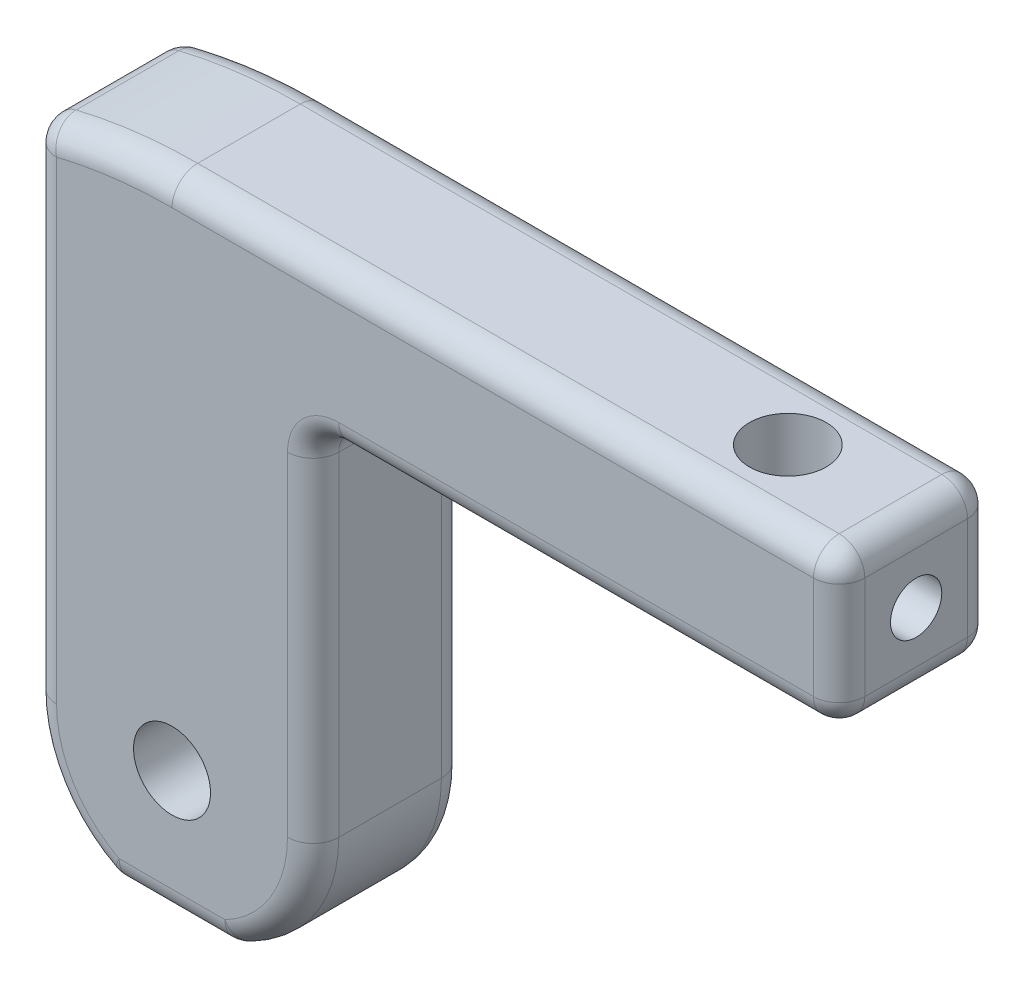
from build123d import *

# Parameters (mm, degrees)
SKETCH_1_W          = 11
SKETCH_1_H          = 20
EXTRUDE_1_DEPTH     = 6
CUT_EXTRUDE_1_DEPTH = 6
SKETCH_3_R          = 5.5
EXTRUDE_2_DEPTH     = 6
SKETCH_4_W          = 24
SKETCH_4_H          = 6
EXTRUDE_3_DEPTH     = 6
SKETCH_6_R          = 1.5
CUT_EXTRUDE_3_DEPTH = 6
SKETCH_7_R          = 1.5
CUT_EXTRUDE_4_DEPTH = 6
SKETCH_5_W          = 6
SKETCH_5_H          = 0.5
CUT_EXTRUDE_5_DEPTH = 10
SKETCH_14_R         = 1
CUT_EXTRUDE_6_DEPTH = 4
SKETCH_15_W         = 6
SKETCH_15_H         = 6
EXTRUDE_4_DEPTH     = 2
SKETCH_16_R         = 1
CUT_EXTRUDE_7_DEPTH = 4
FILLET_2_R          = 1


# Read off the part's stored shape, not the designer's step: 切除-拉伸1
with BuildPart() as part:
    # 草图1 → 凸台-拉伸1 (new body)
    with BuildSketch(Plane.XY):
        with Locations((5.5, 10)):
            Rectangle(SKETCH_1_W, SKETCH_1_H)
    extrude(amount=EXTRUDE_1_DEPTH)

    # 切除-拉伸1 outline → 切除-拉伸1 (cut)
    with BuildSketch(Plane.XY):
        with BuildLine():
            Line((0, 20), (0, 19.228884523))
            ThreePointArc((0, 19.228884523), (2.723103392, 19.806282974), (5.5, 20))
            Line((5.5, 20), (0, 20))
        make_face()
        with BuildLine():
            Line((11, 20), (5.5, 20))
            ThreePointArc((5.5, 20), (8.276896608, 19.806282974), (11, 19.228884523))
            Line((11, 19.228884523), (11, 20))
        make_face()
    extrude(amount=CUT_EXTRUDE_1_DEPTH, mode=Mode.SUBTRACT)

    # 草图3 → 凸台-拉伸2 (add)
    with BuildSketch(Plane.XY):
        with Locations((5.5, 0)):
            Circle(SKETCH_3_R)
    extrude(amount=EXTRUDE_2_DEPTH)

    # 草图4 → 凸台-拉伸3 (add)
    with BuildSketch(Plane.XY):
        with Locations((17.5, 17)):
            Rectangle(SKETCH_4_W, SKETCH_4_H)
    extrude(amount=EXTRUDE_3_DEPTH)

    # 草图6 → 切除-拉伸3 (cut)
    with BuildSketch(Plane.XY):
        with Locations((5.5, 0)):
            Circle(SKETCH_6_R)
    extrude(amount=CUT_EXTRUDE_3_DEPTH, mode=Mode.SUBTRACT)

    # 草图7 → 切除-拉伸4 (cut)
    with BuildSketch(Plane.XZ.offset(-14)):
        with Locations((26.5, 3)):
            Circle(SKETCH_7_R)
    extrude(amount=-CUT_EXTRUDE_4_DEPTH, mode=Mode.SUBTRACT)

    # 草图5 → 切除-拉伸5 (cut)
    with BuildSketch(Plane.XY):
        with Locations((5.5, -5.25)):
            Rectangle(SKETCH_5_W, SKETCH_5_H)
    extrude(amount=CUT_EXTRUDE_5_DEPTH, mode=Mode.SUBTRACT)

    # 草图14 → 切除-拉伸6 (cut)
    with BuildSketch(Plane(origin=(0, -5, 0), x_dir=(-1, 0, 0), z_dir=(0, -1, 0))):
        with Locations(Location((-5.5, -3, 0), (0, 0, 90))):
            Circle(SKETCH_14_R)
    extrude(amount=-CUT_EXTRUDE_6_DEPTH, mode=Mode.SUBTRACT)

    # 草图15 → 凸台-拉伸4 (add)
    with BuildSketch(Plane(origin=(29.5, 0, 0), x_dir=(0, 0, -1), z_dir=(1, 0, 0))):
        with Locations((-3, 17)):
            Rectangle(SKETCH_15_W, SKETCH_15_H)
    extrude(amount=EXTRUDE_4_DEPTH)

    # 草图16 → 切除-拉伸7 (cut)
    with BuildSketch(Plane(origin=(31.5, 0, 0), x_dir=(0, 0, -1), z_dir=(1, 0, 0))):
        with Locations((-3, 17)):
            Circle(SKETCH_16_R)
    extrude(amount=-CUT_EXTRUDE_7_DEPTH, mode=Mode.SUBTRACT)

    # 圆角2
    fillet_2_edges = [part.edges().sort_by_distance(p)[0] for p in [
        (31.5, 17, 0),
        (31.5, 20, 3),
        (31.5, 17, 6),
        (31.5, 14, 3),
        (11, 7, 6),
        (0, 9.614442262, 0),
        (0, 9.614442262, 6),
        (0, 19.228884523, 3),
        (0.871172764, -2.970514841, 0),
        (0.871172764, -2.970514841, 6),
        (2.723103392, 19.806282974, 6),
        (2.723103392, 19.806282974, 0),
        (11, 14, 3),
        (11, 7, 0),
        (21.25, 14, 0),
        (21.25, 14, 6),
        (18.5, 20, 6),
        (18.5, 20, 0),
        (10.128827236, -2.970514841, 6),
        (10.128827236, -2.970514841, 0),
        (7.791287847, -5, 3),
        (3.208712153, -5, 3),
        (5.5, -5, 0),
        (5.5, -5, 6),
    ]]
    fillet(fillet_2_edges, radius=FILLET_2_R)


solid = part.part
